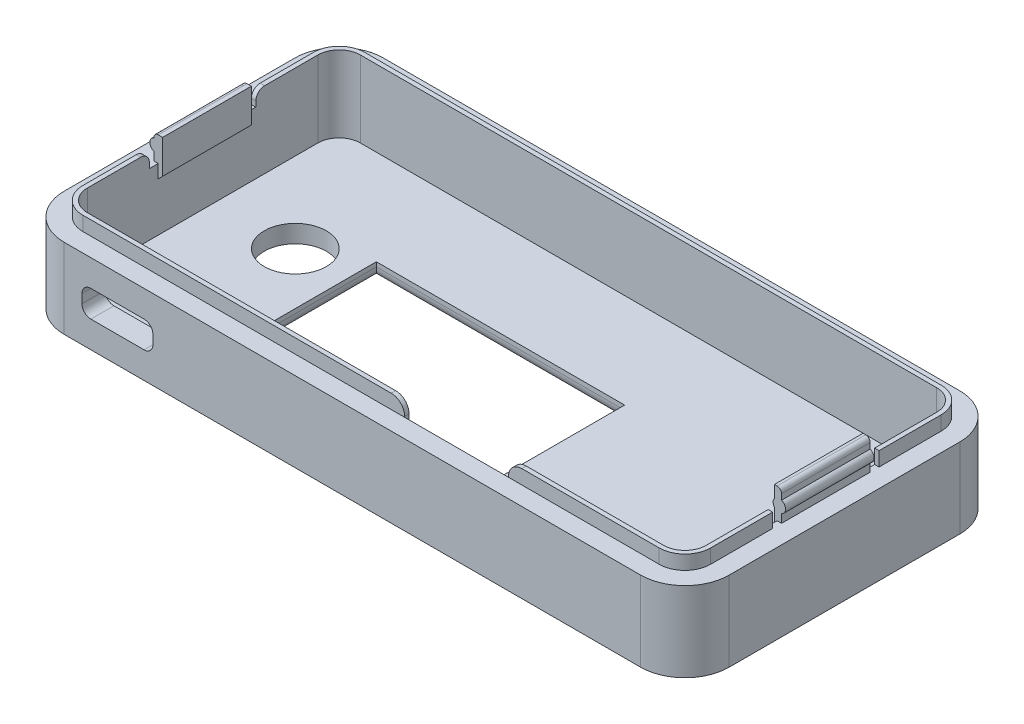
from build123d import *

# Parameters (mm, degrees)
EXTRUDE_2_DEPTH       = 9
EXTRUDE_4_DEPTH       = 1.6
SKETCH_7_W            = 0.5
SKETCH_7_H            = 10
EXTRUDE_8_DEPTH       = 2.8
SKETCH_8_R            = 0.7
EXTRUDE_9_DEPTH       = 10
FILLET_1_R            = 0.5
SKETCH_11_W           = 1
SKETCH_11_H           = 1.6
CUT_EXTRUDE_1_DEPTH   = 1.2
FILLET_2_R            = 1
SKETCH_13_W           = 0.5
SKETCH_13_H           = 10
EXTRUDE_10_DEPTH      = 2.8
CUT_EXTRUDE_START     = -7
CUT_EXTRUDE_2_DEPTH   = 7
SKETCH_13_2_W         = 0.5
SKETCH_13_2_H         = 10
EXTRUDE_11_DEPTH      = 2
EXTRUDE_12_DEPTH      = 1.6
EXTRUDE_12_DEPTH_BACK = 2
SKETCH_5_W            = 0.3
SKETCH_5_H            = 10
SKETCH_17_W           = 0.5
SKETCH_17_H           = 1
CUT_EXTRUDE_3_DEPTH   = 1.6
SKETCH_19_W           = 0.8
SKETCH_19_H           = 10
EXTRUDE_15_DEPTH      = 1.8
SKETCH_20_R           = 0.7
EXTRUDE_16_DEPTH      = 10
FILLET_4_R            = 0.5
CUT_EXTRUDE_12_REACH  = 46.232
SKETCH_27_W           = 28
SKETCH_27_H           = 15.7
FILLET_17_R           = 1.5
CUT_EXTRUDE_13_REACH  = 46.744
SKETCH_37_R           = 3.5
CUT_EXTRUDE_START_2   = -0.5
CUT_EXTRUDE_14_DEPTH  = 0.5
CUT_EXTRUDE_15_REACH  = 46.744
SKETCH_38_W           = 2.5
SKETCH_38_H           = 10
FILLET_18_R           = 1
CUT_EXTRUDE_START_3   = -0.8
CUT_EXTRUDE_16_DEPTH  = 0.8
SKETCH_41_W           = 12
SKETCH_41_H           = 2.5
CUT_EXTRUDE_17_DEPTH  = 1
CHAMFER_1_SIZE        = 1
CUT_EXTRUDE_START_4   = -8.6
SKETCH_42_W           = 11.71
SKETCH_42_H           = 0.5
CUT_EXTRUDE_18_DEPTH  = 8.6
FILLET_20_R           = 1.5
CHAMFER_2_SIZE        = 1
CHAMFER_3_SIZE        = 1
CUT_EXTRUDE_19_REACH  = 56.535
SKETCH_43_W           = 8
SKETCH_43_H           = 3
FILLET_22_R           = 1


# Read off the part's stored shape, not the designer's step: 切除-拉伸14, 切除-拉伸16
# Some blends are built 0.0001 mm under size
with BuildPart() as part:
    # case 2 → 凸台-拉伸2 (new body)
    with BuildSketch(Plane(origin=(0, 0, 0), x_dir=(1, 0, 0), z_dir=(0, 1, 0))):
        with BuildLine():
            Line((-34.042196447, 18), (30.957803553, 18))
            ThreePointArc((30.957803553, 18), (34.493337459, 16.535533906), (35.957803553, 13))
            Line((35.957803553, 13), (35.957803553, -13))
            ThreePointArc((35.957803553, -13), (34.493337459, -16.535533906), (30.957803553, -18))
            Line((30.957803553, -18), (-34.042196447, -18))
            ThreePointArc((-34.042196447, -18), (-37.577730353, -16.535533906), (-39.042196447, -13))
            Line((-39.042196447, -13), (-39.042196447, 13))
            ThreePointArc((-39.042196447, 13), (-37.577730353, 16.535533906), (-34.042196447, 18))
        make_face()
    extrude(amount=EXTRUDE_2_DEPTH)

    # 草图3 → 凸台-拉伸4 (add)
    with BuildSketch(Plane(origin=(0, 9, 0), x_dir=(1, 0, 0), z_dir=(0, 1, 0))):
        with BuildLine():
            Line((-36.942196447, 13), (-36.942196447, -13))
            ThreePointArc((-36.942196447, -13), (-36.092806113, -15.050609665), (-34.042196447, -15.9))
            Line((-34.042196447, -15.9), (30.957803553, -15.9))
            ThreePointArc((30.957803553, -15.9), (33.008413218, -15.050609665), (33.857803553, -13))
            Line((33.857803553, -13), (33.857803553, 13))
            ThreePointArc((33.857803553, 13), (33.008413218, 15.050609665), (30.957803553, 15.9))
            Line((30.957803553, 15.9), (-34.042196447, 15.9))
            ThreePointArc((-34.042196447, 15.9), (-36.092806113, 15.050609665), (-36.942196447, 13))
        make_face()
        with BuildLine():
            Line((-34.042196447, -15.4), (30.957803553, -15.4))
            ThreePointArc((30.957803553, -15.4), (32.654859828, -14.697056275), (33.357803553, -13))
            Line((33.357803553, -13), (33.357803553, 13))
            ThreePointArc((33.357803553, 13), (32.654859828, 14.697056275), (30.957803553, 15.4))
            Line((30.957803553, 15.4), (-34.042196447, 15.4))
            ThreePointArc((-34.042196447, 15.4), (-35.739252722, 14.697056275), (-36.442196447, 13))
            Line((-36.442196447, 13), (-36.442196447, -13))
            ThreePointArc((-36.442196447, -13), (-35.739252722, -14.697056275), (-34.042196447, -15.4))
        make_face(mode=Mode.SUBTRACT)
    extrude(amount=EXTRUDE_4_DEPTH)

    # 草图7 → 凸台-拉伸8 (add)
    with BuildSketch(Plane(origin=(0, 9, 0), x_dir=(1, 0, 0), z_dir=(0, 1, 0))):
        with Locations((-36.692196447, 0)):
            Rectangle(SKETCH_7_W, SKETCH_7_H)
    extrude(amount=EXTRUDE_8_DEPTH)

    # 草图8 → 凸台-拉伸9 (add)
    with BuildSketch(Plane.XY.offset(5)):
        with Locations((-36.692196447, 10.6)):
            Circle(SKETCH_8_R)
    extrude(amount=-EXTRUDE_9_DEPTH)

    # 圆角1
    fillet_1_edges = [part.edges().sort_by_distance(p)[0] for p in [
        (-36.942196447, 11.8, 0),
    ]]
    fillet(fillet_1_edges, radius=FILLET_1_R - 0.0001)  # a hair under: the kernel refuses the full size

    # 草图11 → 切除-拉伸1 (cut)
    with BuildSketch(Plane.ZY.offset(36.942196447)):
        with Locations((5.5, 9.8)):
            Rectangle(SKETCH_11_W, SKETCH_11_H)
        with Locations((-5.5, 9.8)):
            Rectangle(SKETCH_11_W, SKETCH_11_H)
    extrude(amount=-CUT_EXTRUDE_1_DEPTH, mode=Mode.SUBTRACT)

    # 圆角2
    fillet_2_edges = [part.edges().sort_by_distance(p)[0] for p in [
        (-36.692196447, 10.6, 6),
        (-36.692196447, 10.6, -6),
    ]]
    fillet(fillet_2_edges, radius=FILLET_2_R)

    # 草图13 → 凸台-拉伸10 (add)
    with BuildSketch(Plane(origin=(0, 9, 0), x_dir=(1, 0, 0), z_dir=(0, 1, 0))):
        with Locations((-36.192196447, 0)):
            Rectangle(SKETCH_13_W, SKETCH_13_H)
    extrude(amount=EXTRUDE_10_DEPTH)

    # 草图14 → 切除-拉伸2 (cut)
    with BuildSketch(Plane(origin=(0, 9, 0), x_dir=(1, 0, 0), z_dir=(0, 1, 0)).offset(CUT_EXTRUDE_START)):
        with BuildLine():
            Line((-34.042196447, -15.4), (30.957803553, -15.4))
            ThreePointArc((30.957803553, -15.4), (32.654859828, -14.697056275), (33.357803553, -13))
            Line((33.357803553, -13), (33.357803553, 13))
            ThreePointArc((33.357803553, 13), (32.654859828, 14.697056275), (30.957803553, 15.4))
            Line((30.957803553, 15.4), (-34.042196447, 15.4))
            ThreePointArc((-34.042196447, 15.4), (-35.739252722, 14.697056275), (-36.442196447, 13))
            Line((-36.442196447, 13), (-36.442196447, -13))
            ThreePointArc((-36.442196447, -13), (-35.739252722, -14.697056275), (-34.042196447, -15.4))
        make_face()
    extrude(amount=CUT_EXTRUDE_2_DEPTH, mode=Mode.SUBTRACT)

    # 草图13<2> → 凸台-拉伸11 (add)
    with BuildSketch(Plane(origin=(0, 9, 0), x_dir=(1, 0, 0), z_dir=(0, 1, 0))):
        with Locations((-36.192196447, 0)):
            Rectangle(SKETCH_13_2_W, SKETCH_13_2_H)
    extrude(amount=-EXTRUDE_11_DEPTH)

    # 草图5 → 凸台-拉伸12 (add, two sides: drawn at the far end of the back side and taken through both)
    with BuildSketch(Plane(origin=(0, 9, 0), x_dir=(1, 0, 0), z_dir=(0, 1, 0)).offset(-EXTRUDE_12_DEPTH_BACK)):
        with Locations((33.207803553, 0)):
            Rectangle(SKETCH_5_W, SKETCH_5_H)
    extrude(amount=EXTRUDE_12_DEPTH + EXTRUDE_12_DEPTH_BACK)

    # 草图17 → 切除-拉伸3 (cut)
    with BuildSketch(Plane(origin=(0, 10.6, 0), x_dir=(1, 0, 0), z_dir=(0, 1, 0))):
        with Locations((33.607803553, -5.5)):
            Rectangle(SKETCH_17_W, SKETCH_17_H)
        with Locations((33.607803553, 5.5)):
            Rectangle(SKETCH_17_W, SKETCH_17_H)
    extrude(amount=-CUT_EXTRUDE_3_DEPTH, mode=Mode.SUBTRACT)

    # 草图19 → 凸台-拉伸15 (add)
    with BuildSketch(Plane(origin=(0, 10.6, 0), x_dir=(1, 0, 0), z_dir=(0, 1, 0))):
        with Locations((33.457803553, 0)):
            Rectangle(SKETCH_19_W, SKETCH_19_H)
    extrude(amount=EXTRUDE_15_DEPTH)

    # 草图20 → 凸台-拉伸16 (add)
    with BuildSketch(Plane(origin=(0, 0, -5), x_dir=(-1, 0, 0), z_dir=(0, 0, -1))):
        with Locations((-33.607803553, 10.6)):
            Circle(SKETCH_20_R)
    extrude(amount=-EXTRUDE_16_DEPTH)

    # 圆角4
    fillet_4_edges = [part.edges().sort_by_distance(p)[0] for p in [
        (33.857803553, 12.4, 0),
    ]]
    fillet(fillet_4_edges, radius=FILLET_4_R)

    # 草图27 → 切除-拉伸12 (cut, up to next)
    with BuildSketch(Plane(origin=(0, 2, 0), x_dir=(1, 0, 0), z_dir=(0, 1, 0)), mode=Mode.PRIVATE) as cut_extrude_12_sk1:
        with Locations((-7.542196447, -3.15)):
            Rectangle(SKETCH_27_W, SKETCH_27_H)
    cut_extrude_12_tool1 = extrude(cut_extrude_12_sk1.sketch, amount=-CUT_EXTRUDE_12_REACH, mode=Mode.PRIVATE) & part.part
    add(cut_extrude_12_tool1.solids().sort_by_distance((-7.542196, 2, 3.15))[0], mode=Mode.SUBTRACT)

    # 圆角17
    fillet_17_edges = [part.edges().sort_by_distance(p)[0] for p in [
        (-7.542196447, 0, -4.7),
        (6.457803553, 0, 3.15),
        (-7.542196447, 0, 11),
        (-21.542196447, 0, 3.15),
    ]]
    fillet(fillet_17_edges, radius=FILLET_17_R)

    # 草图37 → 切除-拉伸13 (cut, up to next)
    with BuildSketch(Plane.XZ, mode=Mode.PRIVATE) as cut_extrude_13_sk1:
        with Locations(Location((-27.389424243, -1.408334723, 0), (0, 0, 270))):
            Circle(SKETCH_37_R)
    cut_extrude_13_tool1 = extrude(cut_extrude_13_sk1.sketch, amount=-CUT_EXTRUDE_13_REACH, mode=Mode.PRIVATE) & part.part
    add(cut_extrude_13_tool1.solids().sort_by_distance((-27.389424, 0, -1.408335))[0], mode=Mode.SUBTRACT)

    # 切除-拉伸14 outline → 切除-拉伸14 (cut)
    with BuildSketch(Plane.XZ.offset(CUT_EXTRUDE_START_2)):
        with BuildLine():
            Line((-32.307197099, 14.675448373), (-32.594748949, 14.84319914))
            add(Edge.make_bspline(
                [(-32.594748949, 14.84319914), (-32.688625023, 14.895110099), (-32.79244694, 14.923070591), (-33.000139527, 14.923070591), (-33.103985821, 14.895110099), (-33.197837519, 14.84319914)],
                knots=[3, 3, 3, 3, 4, 4, 5, 5, 5, 5], degree=3))
            Line((-33.197837519, 14.84319914), (-33.485413746, 14.675448373))
            Line((-33.485413746, 14.675448373), (-34.977143816, 13.814755176))
            Line((-34.977143816, 13.814755176), (-35.264720043, 13.649003328))
            add(Edge.make_bspline(
                [(-35.264720043, 13.649003328), (-35.450424518, 13.541171384), (-35.566264327, 13.341474474), (-35.566264327, 13.127797317)],
                knots=[8, 8, 8, 8, 9, 9, 9, 9], degree=3))
            Line((-35.566264327, 13.127797317), (-35.566264327, 10.739417881))
            add(Edge.make_bspline(
                [(-35.566264327, 10.739417881), (-35.566264327, 10.523753994), (-35.450424518, 10.326043814), (-35.264720043, 10.21821187)],
                knots=[10, 10, 10, 10, 11, 11, 11, 11], degree=3))
            Line((-35.264720043, 10.21821187), (-34.977143816, 10.052460022))
            Line((-34.977143816, 10.052460022), (-33.485413746, 9.191766826))
            Line((-33.485413746, 9.191766826), (-33.197837519, 9.024028247))
            add(Edge.make_bspline(
                [(-33.197837519, 9.024028247), (-33.103985821, 8.97010618), (-33.000139527, 8.944144607), (-32.79244694, 8.944144607), (-32.688625023, 8.97010618), (-32.594748949, 9.024028247)],
                knots=[14, 14, 14, 14, 15, 15, 16, 16, 16, 16], degree=3))
            Line((-32.594748949, 9.024028247), (-32.307197099, 9.191766826))
            Line((-32.307197099, 9.191766826), (-30.815467029, 10.052460022))
            Line((-30.815467029, 10.052460022), (-30.527915179, 10.21821187))
            add(Edge.make_bspline(
                [(-30.527915179, 10.21821187), (-30.340187407, 10.326043814), (-30.226370894, 10.523753994), (-30.226370894, 10.739417881)],
                knots=[19, 19, 19, 19, 20, 20, 20, 20], degree=3))
            Line((-30.226370894, 10.739417881), (-30.226370894, 13.127797317))
            add(Edge.make_bspline(
                [(-30.226370894, 13.127797317), (-30.226370894, 13.341474474), (-30.340187407, 13.541171384), (-30.527915179, 13.649003328)],
                knots=[21, 21, 21, 21, 22, 22, 22, 22], degree=3))
            Line((-30.527915179, 13.649003328), (-30.815467029, 13.814755176))
            Line((-30.815467029, 13.814755176), (-32.307197099, 14.675448373))
        make_face()
        with BuildLine():
            add(Edge.make_bspline(
                [(-32.171416851, 10.645566184), (-31.943735071, 10.773375132), (-31.835915316, 10.941113711), (-31.835915316, 11.326527285), (-31.959726425, 11.324528366), (-32.18338599, 11.196731607)],
                knots=[0, 0, 0, 0, 1, 1, 2.031545133, 2.031545133, 2.031545133, 2.031545133], degree=3))
            Line((-32.18338599, 11.196731607), (-32.355122407, 11.100868801))
            add(Edge.make_bspline(
                [(-32.3751116, 11.066923739), (-32.3751116, 11.080903986), (-32.367115923, 11.094884232), (-32.355122407, 11.100868801)],
                knots=[4, 4, 4, 4, 5, 5, 5, 5], degree=3))
            Line((-32.3751116, 11.066923739), (-32.3751116, 9.541236419))
            add(Edge.make_bspline(
                [(-32.395052038, 9.507291357), (-32.381083981, 9.515274845), (-32.3751116, 9.527256173), (-32.3751116, 9.541236419)],
                knots=[3, 3, 3, 3, 4, 4, 4, 4], degree=3))
            Line((-32.395052038, 9.507291357), (-32.782476721, 9.287629631))
            add(Edge.make_bspline(
                [(-32.840396625, 9.321574693), (-32.840396625, 9.291615281), (-32.808438294, 9.273649385), (-32.782476721, 9.287629631)],
                knots=[5, 5, 5, 5, 6, 6, 6, 6], degree=3))
            Line((-32.840396625, 9.321574693), (-32.840396625, 11.170770033))
            add(Edge.make_bspline(
                [(-32.82043181, 11.204715095), (-32.834399868, 11.198730526), (-32.840396625, 11.18475028), (-32.840396625, 11.170770033)],
                knots=[7, 7, 7, 7, 8, 8, 8, 8], degree=3))
            Line((-32.82043181, 11.204715095), (-32.161422255, 11.578147342))
            add(Edge.make_bspline(
                [(-32.161422255, 11.578147342), (-31.734067941, 11.819784992), (-31.380624887, 11.8677103), (-31.380624887, 10.927133464), (-31.73806578, 10.521755074), (-32.14742982, 10.290099833)],
                knots=[9, 9, 9, 9, 10, 10, 10.962489192, 10.962489192, 10.962489192, 10.962489192], degree=3))
            Line((-32.14742982, 10.290099833), (-32.355122407, 10.174284401))
            Line((-32.355122407, 10.174284401), (-32.355122407, 10.553701217))
            Line((-32.355122407, 10.553701217), (-32.171416851, 10.645566184))
        make_face(mode=Mode.SUBTRACT)
        with BuildLine():
            add(Edge.make_bspline(
                [(-30.779535236, 10.413910942), (-30.767541721, 10.4199077), (-30.759546043, 10.433887946), (-30.759546043, 10.447868193)],
                knots=[0, 0, 0, 0, 1, 1, 1, 1], degree=3))
            Line((-30.779535236, 10.413910942), (-31.162937703, 10.196248135))
            add(Edge.make_bspline(
                [(-31.220857607, 10.230193197), (-31.220857607, 10.200245974), (-31.188899276, 10.182267889), (-31.162937703, 10.196248135)],
                knots=[2, 2, 2, 2, 3, 3, 3, 3], degree=3))
            Line((-31.220857607, 10.230193197), (-31.220857607, 11.110863398))
            add(Edge.make_bspline(
                [(-31.200868415, 11.14480846), (-31.21286193, 11.136824971), (-31.220857607, 11.124831456), (-31.220857607, 11.110863398)],
                knots=[4, 4, 4, 4, 5, 5, 5, 5], degree=3))
            Line((-31.200868415, 11.14480846), (-30.817465948, 11.360484536))
            add(Edge.make_bspline(
                [(-30.759546043, 11.326527285), (-30.759546043, 11.356486697), (-30.791504375, 11.374452594), (-30.817465948, 11.360484536)],
                knots=[6, 6, 6, 6, 7, 7, 7, 7], degree=3))
            Line((-30.759546043, 11.326527285), (-30.759546043, 10.447868193))
        make_face(mode=Mode.SUBTRACT)
        with BuildLine():
            add(Edge.make_bspline(
                [(-30.989202366, 11.945595021), (-31.144947429, 11.857727892), (-31.254790481, 11.697972802), (-31.254790481, 11.556183608), (-31.254790481, 11.418392252), (-31.144947429, 11.380449351), (-30.989202366, 11.470315399)],
                knots=[0, 0, 0, 0, 1, 1, 1, 2, 2, 2, 2], degree=3))
            add(Edge.make_bspline(
                [(-30.989202366, 11.470315399), (-30.835431845, 11.556183608), (-30.72561317, 11.717937617), (-30.72561317, 11.855728973), (-30.72561317, 11.995519248), (-30.835431845, 12.033462149), (-30.989202366, 11.945595021)],
                knots=[2, 2, 2, 2, 3, 3, 3, 4, 4, 4, 4], degree=3))
        make_face(mode=Mode.SUBTRACT)
        with BuildLine():
            add(Edge.make_bspline(
                [(-33.090017763, 12.097366623), (-32.970204493, 12.027465391), (-32.82043181, 12.027465391), (-32.700594162, 12.097366623)],
                knots=[7, 7, 7, 7, 8, 8, 8, 8], degree=3))
            add(Edge.make_bspline(
                [(-34.899259095, 13.141777563), (-34.895261257, 13.139778644), (-33.090017763, 12.097366623)],
                knots=[0, 0, 0, 1, 1, 1], degree=2))
            add(Edge.make_bspline(
                [(-34.881293199, 13.411363517), (-34.983140573, 13.353455801), (-34.993110793, 13.209667687), (-34.899259095, 13.141777563)],
                knots=[1, 1, 1, 1, 2, 2, 2, 2], degree=3))
            Line((-34.881293199, 13.411363517), (-33.036095697, 14.477750381))
            add(Edge.make_bspline(
                [(-32.754516228, 14.477750381), (-32.842371168, 14.527674609), (-32.9502153, 14.527674609), (-33.036095697, 14.477750381)],
                knots=[3, 3, 3, 3, 4, 4, 4, 4], degree=3))
            Line((-32.754516228, 14.477750381), (-30.919313323, 13.409364598))
            add(Edge.make_bspline(
                [(-30.917314403, 13.163741298), (-30.823462706, 13.219662284), (-30.825461625, 13.35545472), (-30.919313323, 13.409364598)],
                knots=[5, 5, 5, 5, 6, 6, 6, 6], degree=3))
            Line((-30.917314403, 13.163741298), (-32.700594162, 12.097366623))
        make_face(mode=Mode.SUBTRACT)
    extrude(amount=CUT_EXTRUDE_14_DEPTH, mode=Mode.SUBTRACT)

    # 草图38 → 切除-拉伸15 (cut, up to next)
    with BuildSketch(Plane.XZ, mode=Mode.PRIVATE) as cut_extrude_15_sk1:
        with Locations((27.207803553, 3.6)):
            Rectangle(SKETCH_38_W, SKETCH_38_H)
    cut_extrude_15_tool1 = extrude(cut_extrude_15_sk1.sketch, amount=-CUT_EXTRUDE_15_REACH, mode=Mode.PRIVATE) & part.part
    add(cut_extrude_15_tool1.solids().sort_by_distance((27.207804, 0, 3.6))[0], mode=Mode.SUBTRACT)

    # 圆角18
    fillet_18_edges = [part.edges().sort_by_distance(p)[0] for p in [
        (25.957803553, 1, -1.4),
        (25.957803553, 1, 8.6),
        (28.457803553, 1, 8.6),
        (28.457803553, 1, -1.4),
    ]]
    fillet(fillet_18_edges, radius=FILLET_18_R)

    # 切除-拉伸16 outline → 切除-拉伸16 (cut)
    # profile 1 of 6: a face of its own
    with BuildSketch(Plane.XZ.offset(CUT_EXTRUDE_START_3)):
        with BuildLine():
            add(Edge.make_bspline(
                [(26.763952696, -13.193306613), (26.732562049, -13.141201169), (26.672768387, -13.041949462), (26.580023008, -12.904567588), (26.491456271, -12.782940564), (26.398913001, -12.682104314), (26.304740177, -12.599511289), (26.205012076, -12.539234253), (26.098369789, -12.499068687), (26.023629362, -12.49448413), (25.985663222, -12.492155297)],
                knots=[0, 0, 0, 0, 0.166616267, 0.317374686, 0.454054005, 0.578317085, 0.691671191, 0.795890415, 0.896317786, 1, 1, 1, 1], degree=3))
            Line((26.763952696, -13.193306613), (27.635498748, -14.628997402))
            Line((27.635498748, -14.628997402), (29.076946117, -14.628997402))
            Line((29.076946117, -14.628997402), (28.029248748, -12.97801056))
            add(Edge.make_bspline(
                [(27.17842638, -12.132944771), (27.219903779, -12.148233627), (27.30528768, -12.179706724), (27.421472535, -12.259656062), (27.535688341, -12.35388213), (27.644463642, -12.464660789), (27.750635931, -12.585013968), (27.848731156, -12.714695618), (27.942646966, -12.845472875), (28.000774543, -12.934432874), (28.029248748, -12.97801056)],
                knots=[0, 0, 0, 0, 0.108308314, 0.222959649, 0.344272461, 0.472394006, 0.604137966, 0.73872092, 0.872010593, 1, 1, 1, 1], degree=3))
            Line((27.17842638, -12.132944771), (27.17842638, -12.116826349))
            add(Edge.make_bspline(
                [(28.446025064, -10.555642139), (28.445008185, -10.603677907), (28.443008291, -10.698149751), (28.424540036, -10.837001554), (28.398338752, -10.970831216), (28.356776474, -11.097766224), (28.307344014, -11.219068627), (28.248993872, -11.334847366), (28.178691917, -11.443412084), (28.100919759, -11.547175865), (28.013406906, -11.643894305), (27.916743559, -11.732700679), (27.81313698, -11.816378314), (27.700022018, -11.891468903), (27.580487833, -11.961680022), (27.452052768, -12.020222843), (27.318428827, -12.074442573), (27.225497407, -12.102576256), (27.17842638, -12.116826349)],
                knots=[0, 0, 0, 0, 0.066352771, 0.130495854, 0.193325077, 0.254551022, 0.314731918, 0.374271311, 0.433419609, 0.493248882, 0.55333153, 0.613381394, 0.674513074, 0.737180896, 0.800864009, 0.865878345, 0.932065558, 1, 1, 1, 1], degree=3))
            add(Edge.make_bspline(
                [(26.400136906, -9.028997402), (26.482688367, -9.029908666), (26.642639043, -9.031674318), (26.87477777, -9.050761197), (27.090990389, -9.079804765), (27.291449781, -9.121344043), (27.476255286, -9.173579828), (27.645461187, -9.2389218), (27.797689447, -9.317781464), (27.935915577, -9.406053085), (28.055471537, -9.509512707), (28.161043478, -9.622986488), (28.248617503, -9.749927225), (28.321696051, -9.887682002), (28.378842373, -10.037593047), (28.416682293, -10.199922004), (28.441921325, -10.373714378), (28.444629175, -10.493759322), (28.446025064, -10.555642139)],
                knots=[0, 0, 0, 0, 0.085072713, 0.164835824, 0.239912713, 0.309814075, 0.375670734, 0.437670893, 0.496408874, 0.552146374, 0.606294627, 0.65892908, 0.711493621, 0.764757564, 0.819344749, 0.876335745, 0.936251438, 1, 1, 1, 1], degree=3))
            Line((26.400136906, -9.028997402), (24.393393485, -9.028997402))
            Line((24.393393485, -9.028997402), (24.393393485, -14.628997402))
            Line((24.393393485, -14.628997402), (25.646025064, -14.628997402))
            Line((25.646025064, -14.628997402), (25.646025064, -12.492155297))
            Line((25.646025064, -12.492155297), (25.985663222, -12.492155297))
        make_face()
        with BuildLine():
            add(Edge.make_bspline(
                [(27.119709275, -10.715675034), (27.11910839, -10.686091115), (27.117949433, -10.629031076), (27.10727438, -10.546158207), (27.090198069, -10.469014356), (27.066432394, -10.396735471), (27.033473256, -10.331285309), (26.995760355, -10.270071381), (26.94900225, -10.216427139), (26.896847631, -10.166828996), (26.836574245, -10.124913098), (26.770161241, -10.087233058), (26.696494841, -10.056747456), (26.61590457, -10.031445337), (26.528727735, -10.010268263), (26.433793192, -9.99764595), (26.332429982, -9.987401874), (26.262393096, -9.987065529), (26.226288222, -9.986892139)],
                knots=[0, 0, 0, 0, 0.06726802, 0.129743318, 0.189678709, 0.246821831, 0.302259206, 0.35602177, 0.409897607, 0.463631815, 0.519343431, 0.576406483, 0.637043414, 0.700264404, 0.76844385, 0.840788046, 0.917924284, 1, 1, 1, 1], degree=3))
            add(Edge.make_bspline(
                [(26.865268485, -11.301694771), (26.885661612, -11.281760867), (26.925786086, -11.242539937), (26.977672506, -11.177497711), (27.021832942, -11.109306058), (27.057674535, -11.037474026), (27.085850172, -10.961878157), (27.104481798, -10.882509517), (27.118484404, -10.800209079), (27.119296875, -10.744136627), (27.119709275, -10.715675034)],
                knots=[0, 0, 0, 0, 0.129841783, 0.25547006, 0.37819239, 0.499410405, 0.620577955, 0.744847917, 0.870488364, 1, 1, 1, 1], degree=3))
            add(Edge.make_bspline(
                [(26.20211059, -11.53426056), (26.235930219, -11.533787209), (26.301859933, -11.532864433), (26.397502217, -11.520208403), (26.488892172, -11.504066988), (26.574059976, -11.477037973), (26.655330449, -11.444726179), (26.730840855, -11.404408219), (26.801860639, -11.357406822), (26.844169937, -11.320232593), (26.865268485, -11.301694771)],
                knots=[0, 0, 0, 0, 0.140812703, 0.274507487, 0.401531903, 0.526986243, 0.646071424, 0.765542549, 0.883082156, 1, 1, 1, 1], degree=3))
            Line((26.20211059, -11.53426056), (25.646025064, -11.53426056))
            Line((25.646025064, -11.53426056), (25.646025064, -9.986892139))
            Line((25.646025064, -9.986892139), (26.226288222, -9.986892139))
        make_face(mode=Mode.SUBTRACT)
    # profile 2 of 6: a face of its own
    with BuildSketch(Plane.XZ.offset(CUT_EXTRUDE_START_3)):
        with BuildLine():
            add(Edge.make_bspline(
                [(20.486518485, -12.926201349), (20.501374914, -12.977078211), (20.530121695, -13.07552354), (20.560999288, -13.220451699), (20.587149316, -13.355300649), (20.595392139, -13.442667025), (20.599347432, -13.484589507)],
                knots=[0, 0, 0, 0, 0.278523147, 0.538934631, 0.778759223, 1, 1, 1, 1], degree=3))
            Line((20.486518485, -12.926201349), (19.325992169, -9.028997402))
            Line((19.325992169, -9.028997402), (17.975498748, -9.028997402))
            Line((17.975498748, -9.028997402), (19.869413222, -14.628997402))
            Line((19.869413222, -14.628997402), (21.290136906, -14.628997402))
            Line((21.290136906, -14.628997402), (23.207077696, -9.028997402))
            Line((23.207077696, -9.028997402), (21.895729011, -9.028997402))
            Line((21.895729011, -9.028997402), (20.74211059, -12.910082928))
            add(Edge.make_bspline(
                [(20.622373748, -13.484589507), (20.628165818, -13.440021677), (20.640089746, -13.348271474), (20.665359646, -13.207472091), (20.700352398, -13.060613852), (20.727975158, -12.96103867), (20.74211059, -12.910082928)],
                knots=[0, 0, 0, 0, 0.229460129, 0.47238138, 0.730001014, 1, 1, 1, 1], degree=3))
            Line((20.622373748, -13.484589507), (20.599347432, -13.484589507))
        make_face()
    # profile 3 of 6: a face of its own
    with BuildSketch(Plane.XZ.offset(CUT_EXTRUDE_START_3)):
        with BuildLine():
            add(Edge.make_bspline(
                [(10.242340853, -12.613043455), (10.179610732, -12.65616378), (10.055700498, -12.741338964), (9.877231801, -12.870298576), (9.709528786, -12.994472797), (9.564385825, -13.120588748), (9.440797269, -13.242200002), (9.35922889, -13.345887471), (9.310559281, -13.42717391), (9.284981263, -13.484592827), (9.268496313, -13.541241439), (9.266839999, -13.578893151), (9.266025064, -13.597418455)],
                knots=[0, 0, 0, 0, 0.160375386, 0.316788032, 0.463954722, 0.599810878, 0.721597888, 0.828827593, 0.87667161, 0.920841975, 0.96105286, 1, 1, 1, 1], degree=3))
            add(Edge.make_bspline(
                [(11.697604011, -10.539523718), (11.695859777, -10.601741547), (11.692446428, -10.723497614), (11.671569983, -10.901238124), (11.631497243, -11.067858089), (11.578641482, -11.224379378), (11.511660398, -11.370840215), (11.436962508, -11.511511122), (11.350620029, -11.644427446), (11.254398621, -11.770723477), (11.14891286, -11.889896982), (11.037552641, -12.006079975), (10.916109855, -12.114836158), (10.744984371, -12.25428712), (10.520505288, -12.421287641), (10.335606802, -12.548749513), (10.242340853, -12.613043455)],
                knots=[0, 0, 0, 0, 0.070274231, 0.137521897, 0.201645623, 0.263456112, 0.32378572, 0.383312987, 0.443178485, 0.502554106, 0.562444697, 0.622822543, 0.684189306, 0.746395083, 0.872077357, 1, 1, 1, 1], degree=3))
            add(Edge.make_bspline(
                [(9.881979011, -8.955313192), (9.951105153, -8.956614859), (10.086227295, -8.959159253), (10.283486759, -8.979706152), (10.469297904, -9.015669111), (10.643863485, -9.063789898), (10.80672204, -9.124554103), (10.956789057, -9.198187696), (11.093744672, -9.283886926), (11.217724084, -9.381053828), (11.328926651, -9.489595987), (11.426118335, -9.609666567), (11.508312386, -9.741517617), (11.577413672, -9.882952962), (11.631998276, -10.034570432), (11.66924072, -10.195370789), (11.693046788, -10.364583079), (11.696062283, -10.48034055), (11.697604011, -10.539523718)],
                knots=[0, 0, 0, 0, 0.076136194, 0.14882482, 0.218136801, 0.284394431, 0.348073216, 0.409328816, 0.468210251, 0.52571743, 0.582516363, 0.639031411, 0.695448344, 0.753302534, 0.812138424, 0.872533151, 0.934830194, 1, 1, 1, 1], degree=3))
            add(Edge.make_bspline(
                [(8.234446117, -9.425050034), (8.295675676, -9.387223969), (8.417528859, -9.311946171), (8.609646374, -9.216863918), (8.807213955, -9.135438969), (9.011194378, -9.070585569), (9.220584065, -9.017854213), (9.43578948, -8.981662967), (9.656976227, -8.958860064), (9.806319259, -8.956505868), (9.881979011, -8.955313192)],
                knots=[0, 0, 0, 0, 0.124218059, 0.247206838, 0.369651686, 0.492877681, 0.616473746, 0.742195786, 0.869391945, 1, 1, 1, 1], degree=3))
            Line((8.234446117, -9.425050034), (8.234446117, -10.502681613))
            add(Edge.make_bspline(
                [(9.619479011, -9.913207928), (9.559505829, -9.914986562), (9.43931295, -9.91855114), (9.260303047, -9.94734017), (9.083260069, -9.993424647), (8.908415799, -10.058773706), (8.735344679, -10.141911543), (8.564632886, -10.24406807), (8.395695231, -10.363878185), (8.288990407, -10.455729823), (8.234446117, -10.502681613)],
                knots=[0, 0, 0, 0, 0.11678746, 0.234054964, 0.352290892, 0.472700507, 0.597099173, 0.725834873, 0.859855048, 1, 1, 1, 1], degree=3))
            add(Edge.make_bspline(
                [(10.444972432, -10.65926056), (10.442823594, -10.601095634), (10.438757374, -10.491030826), (10.400999488, -10.336519841), (10.335547535, -10.205521636), (10.259909327, -10.114927657), (10.186972879, -10.056760801), (10.126353722, -10.01748584), (10.05819824, -9.984899505), (9.983543981, -9.958954618), (9.901927286, -9.938041708), (9.813760183, -9.923170621), (9.718620531, -9.915664941), (9.653261928, -9.914045166), (9.619479011, -9.913207928)],
                knots=[0, 0, 0, 0, 0.136703988, 0.258683353, 0.370941413, 0.47857603, 0.533149274, 0.590005303, 0.648158595, 0.710415069, 0.775676489, 0.846186152, 0.920495846, 1, 1, 1, 1], degree=3))
            add(Edge.make_bspline(
                [(9.437571117, -11.975214507), (9.515914699, -11.918629463), (9.664419952, -11.811368906), (9.869806944, -11.648962663), (10.043478285, -11.488878745), (10.188617662, -11.330734566), (10.303665636, -11.17193548), (10.386231456, -11.008057085), (10.435718998, -10.836367442), (10.441867962, -10.718678827), (10.444972432, -10.65926056)],
                knots=[0, 0, 0, 0, 0.168174123, 0.318784766, 0.455361744, 0.578769898, 0.691808674, 0.795448475, 0.896726655, 1, 1, 1, 1], degree=3))
            add(Edge.make_bspline(
                [(7.939709275, -14.194951349), (7.941338061, -14.125763847), (7.944518869, -13.990649708), (7.973452196, -13.793750953), (8.017152919, -13.606823865), (8.082772316, -13.43172925), (8.162452581, -13.26740164), (8.24797095, -13.109868225), (8.345046043, -12.962317747), (8.451867014, -12.824234803), (8.5642795, -12.692984422), (8.68311604, -12.570069046), (8.806242692, -12.454036976), (8.976649497, -12.314866768), (9.18643339, -12.154442024), (9.355896617, -12.033502515), (9.437571117, -11.975214507)],
                knots=[0, 0, 0, 0, 0.074122296, 0.144751143, 0.212899553, 0.279538751, 0.344679238, 0.408571093, 0.471554573, 0.533759381, 0.595604021, 0.656702572, 0.716951784, 0.776840371, 0.892445983, 1, 1, 1, 1], degree=3))
            Line((7.939709275, -14.194951349), (7.939709275, -14.628997402))
            Line((7.939709275, -14.628997402), (11.697604011, -14.628997402))
            Line((11.697604011, -14.628997402), (11.697604011, -13.597418455))
            Line((11.697604011, -13.597418455), (9.266025064, -13.597418455))
        make_face()
    # profile 4 of 6: a face of its own
    with BuildSketch(Plane.XZ.offset(CUT_EXTRUDE_START_3)):
        with BuildLine():
            add(Edge.make_bspline(
                [(-1.939501252, -9.028997402), (-1.865029708, -9.030259601), (-1.720538357, -9.032708547), (-1.510161352, -9.047093889), (-1.313362821, -9.073698749), (-1.129507151, -9.109583166), (-0.959786339, -9.158724378), (-0.802017989, -9.215479819), (-0.657775074, -9.284584543), (-0.52719616, -9.364297882), (-0.410157752, -9.452474469), (-0.30926235, -9.550832124), (-0.224217168, -9.658283644), (-0.153455717, -9.773516447), (-0.098605983, -9.898186781), (-0.06124051, -10.031580581), (-0.037431377, -10.173326005), (-0.034451004, -10.270784878), (-0.032922304, -10.320773718)],
                knots=[0, 0, 0, 0, 0.086111784, 0.167076003, 0.243636736, 0.315604137, 0.383442271, 0.447738418, 0.509263166, 0.568013132, 0.624368313, 0.67833919, 0.730452185, 0.782428986, 0.834286324, 0.887374422, 0.942231817, 1, 1, 1, 1], degree=3))
            Line((-1.939501252, -9.028997402), (-3.938185462, -9.028997402))
            Line((-3.938185462, -9.028997402), (-3.938185462, -14.628997402))
            Line((-3.938185462, -14.628997402), (-1.826672304, -14.628997402))
            add(Edge.make_bspline(
                [(0.188130327, -12.935411876), (0.186737777, -12.998819652), (0.184016801, -13.122715395), (0.158236642, -13.303373535), (0.115331369, -13.473770129), (0.056932108, -13.634815774), (-0.019584953, -13.785603206), (-0.113577532, -13.925554482), (-0.224127825, -14.055576883), (-0.350513653, -14.175193224), (-0.492360803, -14.281635483), (-0.646143283, -14.375909583), (-0.813281648, -14.453946994), (-0.992001884, -14.518593229), (-1.183318714, -14.567821997), (-1.386588696, -14.603053), (-1.602425276, -14.625622873), (-1.750627267, -14.627853056), (-1.826672304, -14.628997402)],
                knots=[0, 0, 0, 0, 0.063980294, 0.125014415, 0.183740077, 0.241100441, 0.297582768, 0.353993304, 0.41088997, 0.46953635, 0.52927556, 0.589604776, 0.651299274, 0.71514689, 0.781204705, 0.850438617, 0.923257435, 1, 1, 1, 1], degree=3))
            add(Edge.make_bspline(
                [(-1.101343357, -11.582615823), (-1.053591895, -11.589430276), (-0.959644372, -11.602837214), (-0.823777883, -11.6373846), (-0.694507388, -11.678133559), (-0.572724167, -11.728647405), (-0.45924107, -11.790669976), (-0.352449395, -11.860555941), (-0.252206815, -11.9390588), (-0.161975463, -12.027797844), (-0.080432716, -12.123045202), (-0.008344348, -12.223747914), (0.052753637, -12.329702854), (0.102909117, -12.44106677), (0.1404337, -12.557870167), (0.16845166, -12.679108908), (0.18466102, -12.80564298), (0.186959478, -12.891616439), (0.188130327, -12.935411876)],
                knots=[0, 0, 0, 0, 0.070303358, 0.138316736, 0.204165203, 0.2678883, 0.330249721, 0.392503034, 0.453869322, 0.515617324, 0.57675344, 0.636550183, 0.69597904, 0.754857078, 0.814330728, 0.874617959, 0.936129577, 1, 1, 1, 1], degree=3))
            Line((-1.101343357, -11.582615823), (-1.101343357, -11.566497402))
            add(Edge.make_bspline(
                [(-0.032922304, -10.320773718), (-0.033810344, -10.357270191), (-0.035564896, -10.429378453), (-0.049487767, -10.536293268), (-0.074077667, -10.639294029), (-0.105924125, -10.739569267), (-0.149100821, -10.83531376), (-0.201465858, -10.927922668), (-0.262102241, -11.017753361), (-0.356391912, -11.131243717), (-0.491009931, -11.259486423), (-0.674041585, -11.390149738), (-0.87844639, -11.495393057), (-1.026080776, -11.542488567), (-1.101343357, -11.566497402)],
                knots=[0, 0, 0, 0, 0.06200521, 0.122507397, 0.182773666, 0.241752556, 0.301011975, 0.36086759, 0.422363197, 0.48490106, 0.611275607, 0.73703793, 0.865944483, 1, 1, 1, 1], degree=3))
        make_face()
        with BuildLine():
            add(Edge.make_bspline(
                [(-1.138185462, -12.914688192), (-1.138704252, -12.887392354), (-1.139717585, -12.834076367), (-1.151835388, -12.756600698), (-1.170005618, -12.683608194), (-1.195541292, -12.615294722), (-1.227650796, -12.551058495), (-1.268947397, -12.492326958), (-1.31560845, -12.436323211), (-1.391057994, -12.370424172), (-1.500021727, -12.297521336), (-1.654992105, -12.238919572), (-1.831899549, -12.202654081), (-1.957341008, -12.199227145), (-2.023547304, -12.197418455)],
                knots=[0, 0, 0, 0, 0.063501449, 0.124035115, 0.182118418, 0.238386167, 0.293535902, 0.348808571, 0.405218052, 0.462804318, 0.581520604, 0.708296958, 0.8460431, 1, 1, 1, 1], degree=3))
            add(Edge.make_bspline(
                [(-2.031606515, -13.671102665), (-1.965405636, -13.668909517), (-1.839085406, -13.664724693), (-1.660849073, -13.626931049), (-1.505056652, -13.563168121), (-1.393891369, -13.488263261), (-1.319416477, -13.416766774), (-1.270761186, -13.358880219), (-1.228917386, -13.296604379), (-1.195310437, -13.229273184), (-1.169884107, -13.156851107), (-1.151985801, -13.080004395), (-1.139699718, -12.998740753), (-1.138697942, -12.943134633), (-1.138185462, -12.914688192)],
                knots=[0, 0, 0, 0, 0.149925312, 0.286077774, 0.410470854, 0.529419024, 0.587251437, 0.644054111, 0.700509365, 0.756917688, 0.814145061, 0.874065956, 0.935575879, 1, 1, 1, 1], degree=3))
            Line((-2.031606515, -13.671102665), (-2.685553883, -13.671102665))
            Line((-2.685553883, -13.671102665), (-2.685553883, -12.197418455))
            Line((-2.685553883, -12.197418455), (-2.023547304, -12.197418455))
        make_face(mode=Mode.SUBTRACT)
        with BuildLine():
            add(Edge.make_bspline(
                [(-1.359238094, -10.569457928), (-1.361497161, -10.523403653), (-1.365799275, -10.435698998), (-1.409394165, -10.313646022), (-1.479450515, -10.20981917), (-1.578561381, -10.124730854), (-1.70643359, -10.062356203), (-1.859595015, -10.018717799), (-2.03907006, -9.991078204), (-2.167732064, -9.988350773), (-2.236540725, -9.986892139)],
                knots=[0, 0, 0, 0, 0.115482616, 0.219922315, 0.321419458, 0.427510883, 0.544533228, 0.676506008, 0.826994855, 1, 1, 1, 1], degree=3))
            add(Edge.make_bspline(
                [(-2.158251252, -11.239523718), (-2.09935825, -11.237461177), (-1.987052962, -11.233528039), (-1.828572181, -11.200077908), (-1.689252845, -11.14493487), (-1.571398017, -11.065989476), (-1.476781946, -10.966878437), (-1.406189864, -10.8503624), (-1.366919606, -10.714648136), (-1.36187035, -10.619210877), (-1.359238094, -10.569457928)],
                knots=[0, 0, 0, 0, 0.149921494, 0.285890953, 0.410451161, 0.52950521, 0.644311574, 0.756999804, 0.873320163, 1, 1, 1, 1], degree=3))
            Line((-2.158251252, -11.239523718), (-2.685553883, -11.239523718))
            Line((-2.685553883, -11.239523718), (-2.685553883, -9.986892139))
            Line((-2.685553883, -9.986892139), (-2.236540725, -9.986892139))
        make_face(mode=Mode.SUBTRACT)
    # profile 5 of 6: a face of its own
    with BuildSketch(Plane.XZ.offset(CUT_EXTRUDE_START_3)):
        Polygon((14.431288222, -14.628997402), (15.683919801, -14.628997402), (15.683919801, -10.060576349), (17.304972432, -10.060576349), (17.304972432, -9.028997402), (12.883919801, -9.028997402), (12.883919801, -10.060576349), (14.431288222, -10.060576349), align=None)
    # profile 6 of 6: a face of its own
    with BuildSketch(Plane.XZ.offset(CUT_EXTRUDE_START_3)):
        Polygon((5.206025064, -14.628997402), (6.458656643, -14.628997402), (6.458656643, -9.028997402), (5.206025064, -9.028997402), (5.206025064, -11.239523718), (2.921814538, -11.239523718), (2.921814538, -9.028997402), (1.669182959, -9.028997402), (1.669182959, -14.628997402), (2.921814538, -14.628997402), (2.921814538, -12.344786876), (5.206025064, -12.344786876), align=None)
    extrude(amount=CUT_EXTRUDE_16_DEPTH, mode=Mode.SUBTRACT)

    # 草图41 → 切除-拉伸17 (cut)
    with BuildSketch(Plane(origin=(0, 2, 0), x_dir=(1, 0, 0), z_dir=(0, 1, 0))):
        with Locations((-7.542196447, -12.92)):
            Rectangle(SKETCH_41_W, SKETCH_41_H)
    extrude(amount=-CUT_EXTRUDE_17_DEPTH, mode=Mode.SUBTRACT)

    # 倒角1
    # the kernel refuses this chamfer: 1 mm, written as the material it takes off along each edge
    with BuildSketch(Plane(origin=(33.057803553, 7, 7.571682988), x_dir=(0.9996219169112968, -0.027495876610586414, 0), z_dir=(0, 0, -1))) as chamfer_1_piece_1_section:
        Polygon((CHAMFER_1_SIZE * 0.999621916911, -CHAMFER_1_SIZE * 0.0274958766106), (-CHAMFER_1_SIZE * 0.0274958766106, -CHAMFER_1_SIZE * 0.999621916911), (0, 0), align=None)
    chamfer_1_piece_1 = extrude(amount=15.143365976, mode=Mode.PRIVATE)
    chamfer_1_piece_1 = split(chamfer_1_piece_1, bisect_by=Plane(origin=(33.357803553, 7.436497273, 0), z_dir=(-1, 0, 0)), keep=Keep.TOP, mode=Mode.PRIVATE)
    add(chamfer_1_piece_1, mode=Mode.SUBTRACT)
    with BuildSketch(Plane(origin=(-35.942196447, 7, 7.571682988), x_dir=(-0.9996219169112968, -0.027495876610586414, 0), z_dir=(0, 0, -1))) as chamfer_1_piece_2_section:
        Polygon((CHAMFER_1_SIZE * 0.999621916911, CHAMFER_1_SIZE * 0.0274958766106), (-CHAMFER_1_SIZE * 0.0274958766106, CHAMFER_1_SIZE * 0.999621916911), (0, 0), align=None)
    chamfer_1_piece_2 = extrude(amount=15.143365976, mode=Mode.PRIVATE)
    chamfer_1_piece_2 = split(chamfer_1_piece_2, bisect_by=Plane(origin=(-36.442196447, 7.393401084, 0), z_dir=(1, 0, 0)), keep=Keep.TOP, mode=Mode.PRIVATE)
    add(chamfer_1_piece_2, mode=Mode.SUBTRACT)

    # 草图42 → 切除-拉伸18 (cut)
    with BuildSketch(Plane(origin=(0, 10.6, 0), x_dir=(1, 0, 0), z_dir=(0, 1, 0)).offset(CUT_EXTRUDE_START_4)):
        with Locations((8.102803553, -15.65)):
            Rectangle(SKETCH_42_W, SKETCH_42_H)
    extrude(amount=CUT_EXTRUDE_18_DEPTH, mode=Mode.SUBTRACT)

    # 圆角20
    fillet_20_edges = [part.edges().sort_by_distance(p)[0] for p in [
        (13.957803553, 10.6, 15.65),
        (2.247803553, 10.6, 15.65),
    ]]
    fillet(fillet_20_edges, radius=FILLET_20_R)

    # 倒角2
    chamfer_2_edges = [part.edges().sort_by_distance(p)[0] for p in [
        (-7.542196447, 1, 11.67),
    ]]
    chamfer(chamfer_2_edges, length=CHAMFER_2_SIZE - 0.0001)  # a hair under: the kernel refuses the full size

    # 倒角3
    chamfer_3_edges = [part.edges().sort_by_distance(p)[0] for p in [
        (-1.542196447, 2, 12.92),
    ]]
    chamfer(chamfer_3_edges, length=CHAMFER_3_SIZE - 0.0001)  # a hair under: the kernel refuses the full size
    chamfer_3_2_edges = [part.edges().sort_by_distance(p)[0] for p in [
        (-7.542196447, 2, 14.17),
    ]]
    chamfer(chamfer_3_2_edges, length=CHAMFER_3_SIZE - 0.0001)  # a hair under: the kernel refuses the full size
    chamfer_3_3_edges = [part.edges().sort_by_distance(p)[0] for p in [
        (-13.542196447, 2, 12.92),
    ]]
    chamfer(chamfer_3_3_edges, length=CHAMFER_3_SIZE - 0.0001)  # a hair under: the kernel refuses the full size

    # 草图43 → 切除-拉伸19 (cut, up to next)
    with BuildSketch(Plane.XY.offset(18), mode=Mode.PRIVATE) as cut_extrude_19_sk1:
        with Locations((-28.042196447, 4.5)):
            Rectangle(SKETCH_43_W, SKETCH_43_H)
    cut_extrude_19_tool1 = extrude(cut_extrude_19_sk1.sketch, amount=-CUT_EXTRUDE_19_REACH, mode=Mode.PRIVATE) & part.part
    add(cut_extrude_19_tool1.solids().sort_by_distance((-28.042196, 4.5, 18))[0], mode=Mode.SUBTRACT)

    # 圆角22
    fillet_22_edges = [part.edges().sort_by_distance(p)[0] for p in [
        (-24.042196447, 6, 16.7),
        (-24.042196447, 3, 16.7),
        (-32.042196447, 3, 16.7),
        (-32.042196447, 6, 16.7),
    ]]
    fillet(fillet_22_edges, radius=FILLET_22_R)


solid = part.part
